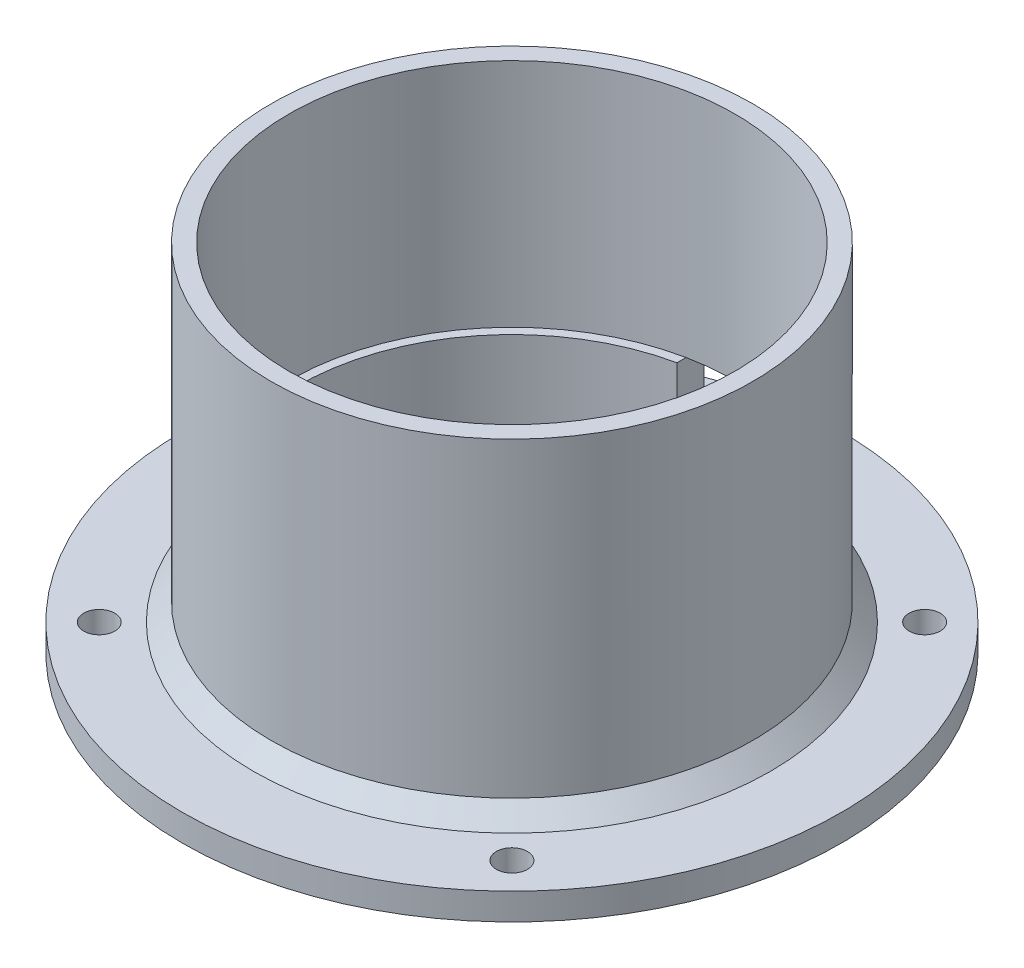
from build123d import *

# Parameters (mm, degrees)
SKETCH3_R          = 1.75
CUT_EXTRUDE1_DEPTH = 10
SKETCH5_W          = 10
SKETCH5_H          = 10
CUT_EXTRUDE3_DEPTH = 50
CHAMFER1_START     = -23
CHAMFER1_2_DEPTH   = 2


with BuildPart() as part:
    # Sketch2 → Revolve1 (revolve)
    with BuildSketch(Plane.XY, mode=Mode.PRIVATE) as revolve1_sk:
        Polygon((25.1, 13), (27.1, 13), (27.1, -24), (37.1, -24), (37.1, -27), (24.1, -27), (24.1, -13), (25.1, -13), align=None)
    revolve(revolve1_sk.sketch.rotate(Axis((0, 0, 0), (0, -1, 0)), 90), axis=Axis((0, 0, 0), (0, -1, 0)))

    # Sketch3 → Cut-Extrude1 (cut)
    with BuildSketch(Plane(origin=(0, -24, 0), x_dir=(1, 0, 0), z_dir=(0, 1, 0))):
        with Locations(Location((-23.228457762, 23.228457762, 0), (0, 0, 270))):
            Circle(SKETCH3_R)
        with Locations(Location((23.228457762, 23.228457762, 0), (0, 0, 270))):
            Circle(SKETCH3_R)
        with Locations(Location((23.228457762, -23.228457762, 0), (0, 0, 270))):
            Circle(SKETCH3_R)
        with Locations(Location((-23.228457762, -23.228457762, 0), (0, 0, 270))):
            Circle(SKETCH3_R)
    extrude(amount=-CUT_EXTRUDE1_DEPTH, mode=Mode.SUBTRACT)

    # Sketch5 → Cut-Extrude3 (cut)
    with BuildSketch(Plane.XY):
        with Locations((0, -18)):
            Rectangle(SKETCH5_W, SKETCH5_H)
    extrude(amount=-CUT_EXTRUDE3_DEPTH, mode=Mode.SUBTRACT)

    # Chamfer1: read off the stored shape, not the designer's step
    # Chamfer1 outline → Chamfer1 (revolve)
    with BuildSketch(Plane.XY):
        Polygon((29.1, -24), (27.1, -22), (27.1, -24), align=None)
    revolve(axis=Axis((0, 0, 0), (0, 1, 0)))

    # Chamfer1 2 outline → Chamfer1 2 (cut)
    with BuildSketch(Plane(origin=(0, 0, 0), x_dir=(1, 0, 0), z_dir=(0, 1, 0)).offset(CHAMFER1_START)):
        with BuildLine():
            ThreePointArc((5, 27.651582233), (0, 28.1), (-5, 27.651582233))
            Line((-5, 27.651582233), (-5, 23.575623003))
            ThreePointArc((-5, 23.575623003), (0, 24.1), (5, 23.575623003))
            Line((5, 23.575623003), (5, 27.651582233))
        make_face()
    extrude(amount=CHAMFER1_2_DEPTH, mode=Mode.SUBTRACT)


solid = part.part
